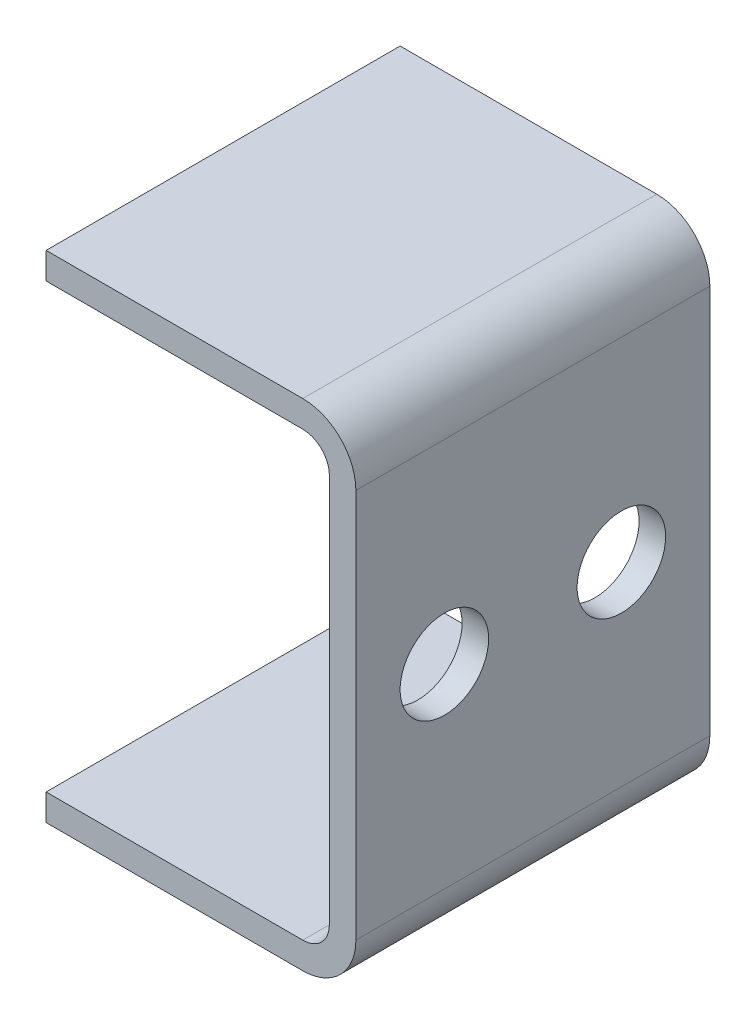
from build123d import *

# Parameters (mm, degrees)
BASE_FLANGE1_DEPTH = 50
SKETCH10_R         = 5
CUT_EXTRUDE2_DEPTH = 68.149087857
FILLET1_R          = 3
SKETCH11_W         = 62.490132504
SKETCH11_H         = 65.671220534
CUT_EXTRUDE4_DEPTH = 5


# Sheet-metal steps are written as plain solids
with BuildPart() as part:
    # Sketch3 → Base-Flange1 (new body)
    with BuildSketch(Plane.XY):
        with BuildLine():
            Line((-8, -25), (21, -25))
            ThreePointArc((21, -25), (23.121320344, -24.121320344), (24, -22))
            Line((24, -22), (24, 22))
            ThreePointArc((24, 22), (23.121320344, 24.121320344), (21, 25))
            Line((21, 25), (-8, 25))
            Line((-8, 25), (-8, 28))
            Line((-8, 28), (21, 28))
            ThreePointArc((21, 28), (25.242640687, 26.242640687), (27, 22))
            Line((27, 22), (27, -22))
            ThreePointArc((27, -22), (25.242640687, -26.242640687), (21, -28))
            Line((21, -28), (-8, -28))
            Line((-8, -28), (-8, -25))
        make_face()
    extrude(amount=-BASE_FLANGE1_DEPTH)

    # Sketch10 → Cut-Extrude2 (cut, through all)
    with BuildSketch(Plane(origin=(27, 0, 0), x_dir=(0, 0, -1), z_dir=(1, 0, 0))):
        with Locations((15, 0)):
            Circle(SKETCH10_R)
        with Locations((35, 0)):
            Circle(SKETCH10_R)
    extrude(amount=-CUT_EXTRUDE2_DEPTH, mode=Mode.SUBTRACT)

    # Fillet1
    fillet1_edges = [part.edges().sort_by_distance(p)[0] for p in [
        (-8, 26.5, 0),
        (-8, -26.5, 0),
        (-8, 26.5, -50),
        (-8, -26.5, -50),
    ]]
    fillet(fillet1_edges, radius=FILLET1_R)

    # Sketch11 → Cut-Extrude4 (cut)
    with BuildSketch(Plane.XY):
        Rectangle(SKETCH11_W, SKETCH11_H)
    cut_extrude4 = extrude(amount=-CUT_EXTRUDE4_DEPTH, mode=Mode.SUBTRACT)

    # Mirror1: Cut-Extrude4 across plane
    add(cut_extrude4.mirror(Plane.XY.offset(-25)), mode=Mode.SUBTRACT)


solid = part.part
